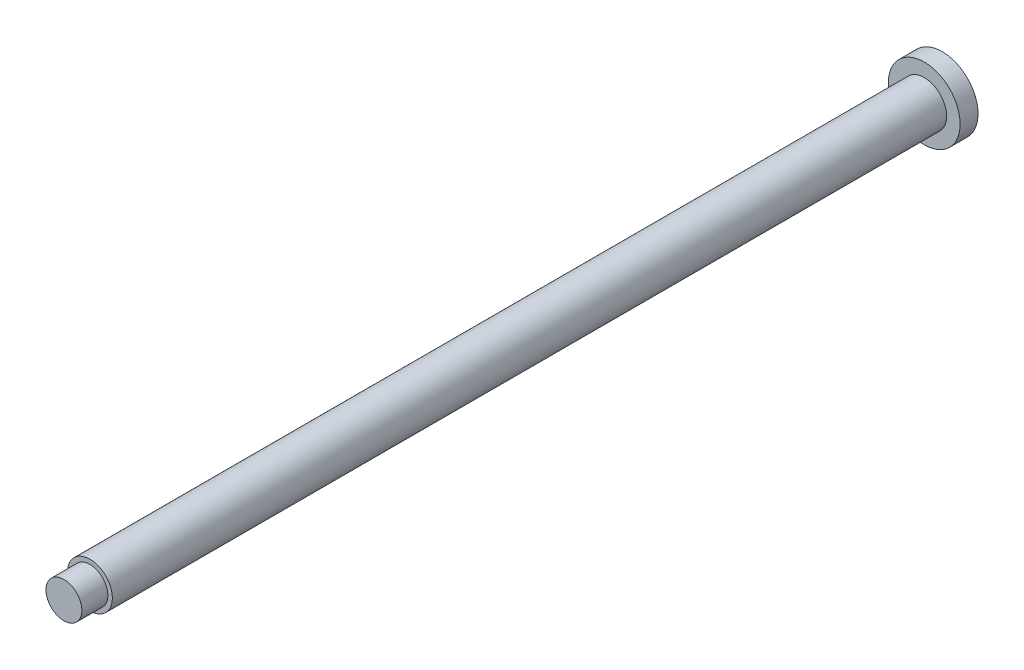
from build123d import *

# Parameters (mm, degrees)
SKETCH1_R           = 2.5
BOSS_EXTRUDE1_DEPTH = 93
SKETCH2_R           = 4
BOSS_EXTRUDE2_DEPTH = 2
SKETCH3_R           = 2.05
CUT_EXTRUDE1_DEPTH  = 3
SKETCH4_R           = 2
BOSS_EXTRUDE3_DEPTH = 2.9


with BuildPart() as part:
    # Sketch1 → Boss-Extrude1 (new body)
    with BuildSketch(Plane(origin=(0, 0, 0), x_dir=(0, 1, 0), z_dir=(0, 0, 1))):
        Circle(SKETCH1_R)
    extrude(amount=BOSS_EXTRUDE1_DEPTH)

    # Sketch2 → Boss-Extrude2 (add)
    with BuildSketch(Plane(origin=(0, 0, 0), x_dir=(1, 0, 0), z_dir=(0, 0, -1))):
        Circle(SKETCH2_R)
    extrude(amount=BOSS_EXTRUDE2_DEPTH)

    # Sketch3 → Cut-Extrude1 (cut)
    with BuildSketch(Plane(origin=(0, 0, -2), x_dir=(1, 0, 0), z_dir=(0, 0, -1))):
        Circle(SKETCH3_R)
    extrude(amount=-CUT_EXTRUDE1_DEPTH, mode=Mode.SUBTRACT)

    # Sketch4 → Boss-Extrude3 (add)
    with BuildSketch(Plane.XY.offset(93)):
        Circle(SKETCH4_R)
    extrude(amount=BOSS_EXTRUDE3_DEPTH)


solid = part.part
